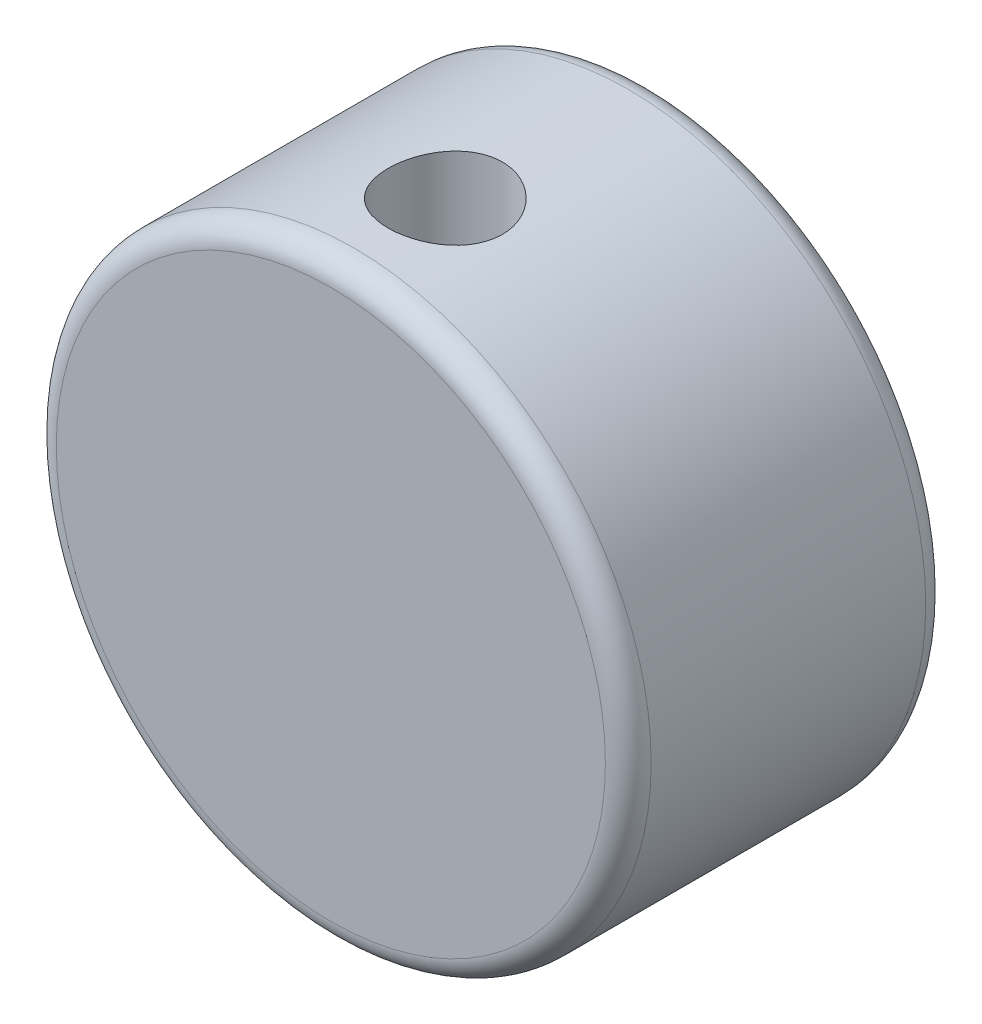
from build123d import *

# Parameters (mm, degrees)
SKETCH1_R           = 65
BOSS_EXTRUDE1_DEPTH = 70
SKETCH4_R           = 12.5
CUT_EXTRUDE3_DEPTH  = 66.5
SKETCH2_R           = 50
CUT_EXTRUDE4_DEPTH  = 10
SKETCH5_R           = 60
CUT_EXTRUDE5_DEPTH  = 10
RACCORDO1_R         = 5


with BuildPart() as part:
    # Sketch1 → Boss-Extrude1 (new body)
    with BuildSketch(Plane.XY):
        Circle(SKETCH1_R)
    extrude(amount=BOSS_EXTRUDE1_DEPTH)

    # Sketch4 → Cut-Extrude3 (cut, symmetric)
    with BuildSketch(Plane(origin=(0, 0, 0), x_dir=(1, 0, 0), z_dir=(0, 1, 0))):
        with Locations((0, -45)):
            Circle(SKETCH4_R)
    extrude(amount=CUT_EXTRUDE3_DEPTH, both=True, mode=Mode.SUBTRACT)

    # Sketch2 → Cut-Extrude4 (cut)
    with BuildSketch(Plane(origin=(0, 0, 0), x_dir=(-1, 0, 0), z_dir=(0, 0, -1))):
        Circle(SKETCH2_R)
    extrude(amount=-CUT_EXTRUDE4_DEPTH, mode=Mode.SUBTRACT)

    # Sketch5 → Cut-Extrude5 (cut)
    with BuildSketch(Plane(origin=(0, 0, 10), x_dir=(-1, 0, 0), z_dir=(0, 0, -1))):
        Circle(SKETCH5_R)
    extrude(amount=-CUT_EXTRUDE5_DEPTH, mode=Mode.SUBTRACT)

    # Raccordo1
    raccordo1_edges = [part.edges().sort_by_distance(p)[0] for p in [
        (-65, 0, 0),
        (-65, 0, 70),
    ]]
    fillet(raccordo1_edges, radius=RACCORDO1_R)


solid = part.part
